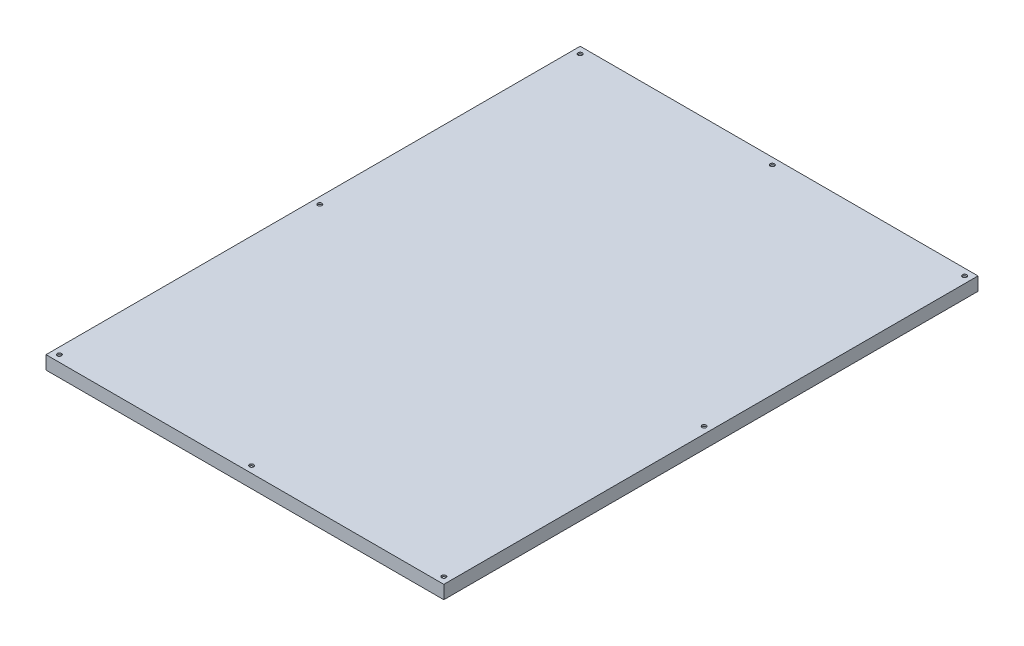
from build123d import *

# Parameters (mm, degrees)
SKETCH1_W           = 297.5
SKETCH1_H           = 399.5
BOSS_EXTRUDE1_DEPTH = 10
SKETCH2_R           = 1.6
CUT_EXTRUDE1_DEPTH  = 1.2


with BuildPart() as part:
    # Sketch1 → Boss-Extrude1 (new body)
    with BuildSketch(Plane(origin=(0, 0, 0), x_dir=(1, 0, 0), z_dir=(0, 1, 0))):
        with Locations((148.75, 199.75)):
            Rectangle(SKETCH1_W, SKETCH1_H)
    extrude(amount=BOSS_EXTRUDE1_DEPTH)

    # Sketch2 → Cut-Extrude1 (cut)
    with BuildSketch(Plane(origin=(0, 10, 0), x_dir=(1, 0, 0), z_dir=(0, 1, 0))):
        with Locations((292.5, 199.75)):
            Circle(SKETCH2_R)
        with Locations((292.5, 5)):
            Circle(SKETCH2_R)
        with Locations((148.75, 5)):
            Circle(SKETCH2_R)
        with Locations((5, 5)):
            Circle(SKETCH2_R)
        with Locations((5, 199.75)):
            Circle(SKETCH2_R)
        with Locations((292.5, 394.5)):
            Circle(SKETCH2_R)
        with Locations((148.75, 394.5)):
            Circle(SKETCH2_R)
        with Locations((5, 394.5)):
            Circle(SKETCH2_R)
    extrude(amount=-CUT_EXTRUDE1_DEPTH, mode=Mode.SUBTRACT)


solid = part.part
